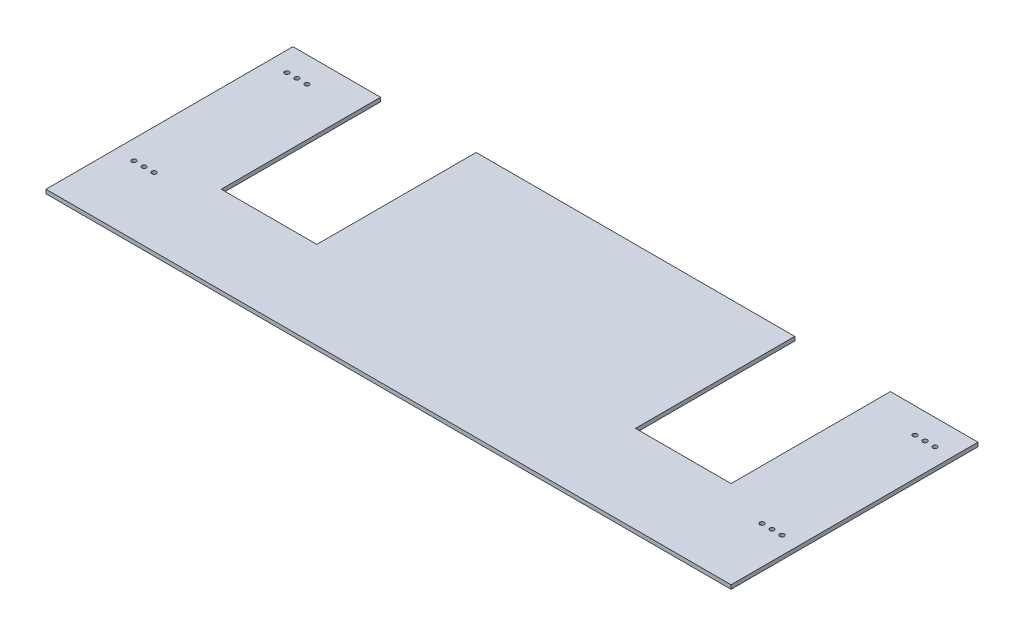
from build123d import *

# Parameters (mm, degrees)
SKETCH1_W           = 546.1
SKETCH1_H           = 3.175
BOSS_EXTRUDE1_DEPTH = 184.15
SKETCH2_R           = 1.778
CUT_EXTRUDE2_DEPTH  = 330.359386727
SKETCH5_W           = 546.1
SKETCH5_H           = 3.175
BOSS_EXTRUDE2_DEPTH = 12.7
SKETCH6_W           = 76.2
SKETCH6_H           = 127
CUT_EXTRUDE4_DEPTH  = 330.359386727


with BuildPart() as part:
    # Sketch1 → Boss-Extrude1 (new body)
    with BuildSketch(Plane.XY):
        Rectangle(SKETCH1_W, SKETCH1_H)
    extrude(amount=BOSS_EXTRUDE1_DEPTH)

    # Sketch2 → Cut-Extrude2 (cut, through all)
    with BuildSketch(Plane(origin=(0, 1.5875, 0), x_dir=(1, 0, 0), z_dir=(0, 1, 0))):
        with Locations((-257.556, -7.62)):
            Circle(SKETCH2_R)
        with Locations((259.08, -129.54)):
            Circle(SKETCH2_R)
        with Locations((-257.556, -129.54)):
            Circle(SKETCH2_R)
        with Locations((259.08, -7.62)):
            Circle(SKETCH2_R)
        with Locations((243.078, -129.54)):
            Circle(SKETCH2_R)
        with Locations((-241.554, -129.54)):
            Circle(SKETCH2_R)
        with Locations((-249.555, -7.62)):
            Circle(SKETCH2_R)
        with Locations((-241.554, -7.62)):
            Circle(SKETCH2_R)
        with Locations((-249.555, -129.54)):
            Circle(SKETCH2_R)
        with Locations((251.079, -129.54)):
            Circle(SKETCH2_R)
        with Locations((243.078, -7.62)):
            Circle(SKETCH2_R)
        with Locations((251.079, -7.62)):
            Circle(SKETCH2_R)
    extrude(amount=-CUT_EXTRUDE2_DEPTH, mode=Mode.SUBTRACT)

    # Sketch5 → Boss-Extrude2 (add)
    with BuildSketch(Plane(origin=(0, 0, 0), x_dir=(-1, 0, 0), z_dir=(0, 0, -1))):
        Rectangle(SKETCH5_W, SKETCH5_H)
    extrude(amount=BOSS_EXTRUDE2_DEPTH)

    # Sketch6 → Cut-Extrude4 (cut, through all)
    with BuildSketch(Plane(origin=(0, 1.5875, 0), x_dir=(1, 0, 0), z_dir=(0, 1, 0))):
        with Locations((165.1, -50.8)):
            Rectangle(SKETCH6_W, SKETCH6_H)
        with Locations((-165.1, -50.8)):
            Rectangle(SKETCH6_W, SKETCH6_H)
    extrude(amount=-CUT_EXTRUDE4_DEPTH, mode=Mode.SUBTRACT)


solid = part.part
